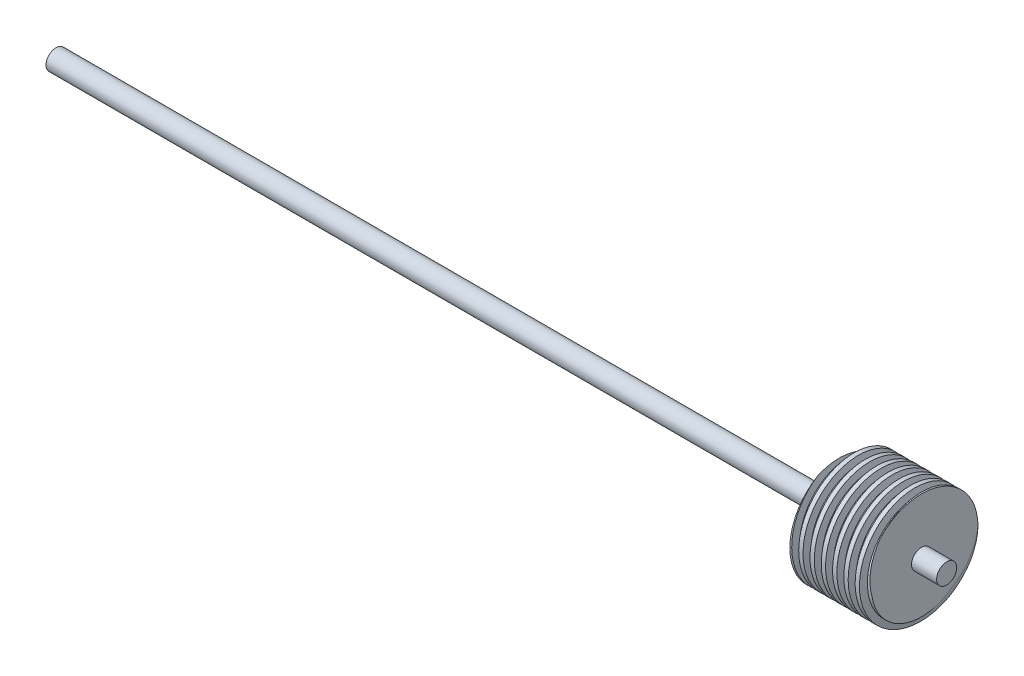
from build123d import *

# Parameters (mm, degrees)
SKETCH1_R                = 22.5
BOSS_EXTRUDE1_DEPTH      = 30
CUT_SWEEP1_PITCH         = 4.5
BOSS_EXTRUDE2_DEPTH      = 315
BOSS_EXTRUDE2_DEPTH_BACK = 40
SKETCH4_R                = 4


with BuildPart() as part:
    # Sketch1 → Boss-Extrude1 (new body)
    with BuildSketch(Plane(origin=(0, 0, 0), x_dir=(0, 0, -1), z_dir=(1, 0, 0))):
        Circle(SKETCH1_R)
    extrude(amount=BOSS_EXTRUDE1_DEPTH)

    # Cut-Sweep1: the profile of Sketch3 profile screwed along a right-hand helix of 14.333333 turns, 12 arcs to a turn; built about Z, then put on its axis
    cut_sweep1_z = Axis((0, 0, 0), (0, 0, 1))
    cut_sweep1_corners = [(22.5003, 0, 7.7585e-05), (22.5003, 0, -2.793165507), (20, 0, -2.146543961), (20, 0, -0.646543961)]
    with BuildLine(mode=Mode.PRIVATE) as cut_sweep1_profile:
        Line(cut_sweep1_corners[0], cut_sweep1_corners[1])
        Line(cut_sweep1_corners[1], cut_sweep1_corners[2])
        Line(cut_sweep1_corners[2], cut_sweep1_corners[3])
        Line(cut_sweep1_corners[3], cut_sweep1_corners[0])
    cut_sweep1_cap = Face(cut_sweep1_profile.wire())
    cut_sweep1_turn_angles = [0, 15, 30, 45, 60, 75, 90, 105, 120, 135, 150, 165, 180, 195, 210, 225, 240, 255, 270, 285, 300, 315, 330, 345, 360]
    cut_sweep1_turn_weights = [1, 0.9659258262890683, 1, 0.9659258262890683, 1, 0.9659258262890683, 1, 0.9659258262890683, 1, 0.9659258262890683, 1, 0.9659258262890683, 1, 0.9659258262890683, 1, 0.9659258262890683, 1, 0.9659258262890683, 1, 0.9659258262890683, 1, 0.9659258262890683, 1, 0.9659258262890683, 1]
    cut_sweep1_turn_rails = [Edge.make_bspline([Vector(p[0], p[1], 0).rotate(cut_sweep1_z, cut_sweep1_turn_angles[k]) / cut_sweep1_turn_weights[k] + Vector(0, 0, p[2] + CUT_SWEEP1_PITCH * cut_sweep1_turn_angles[k] / 360) for k in range(25)], [0, 0, 0, 1, 1, 2, 2, 3, 3, 4, 4, 5, 5, 6, 6, 7, 7, 8, 8, 9, 9, 10, 10, 11, 11, 12, 12, 12], 2, cut_sweep1_turn_weights) for p in cut_sweep1_corners]
    cut_sweep1_turn_sides = [Face.make_surface_from_curves(cut_sweep1_turn_rails[p[0]], cut_sweep1_turn_rails[p[1]]) for p in [(0, 1), (1, 2), (2, 3), (3, 0)]]
    cut_sweep1_last_angles = [5040, 5055, 5070, 5085, 5100, 5115, 5130, 5145, 5160]
    cut_sweep1_last_weights = [1, 0.9659258262890683, 1, 0.9659258262890683, 1, 0.9659258262890683, 1, 0.9659258262890601, 1]
    cut_sweep1_last_rails = [Edge.make_bspline([Vector(p[0], p[1], 0).rotate(cut_sweep1_z, cut_sweep1_last_angles[k]) / cut_sweep1_last_weights[k] + Vector(0, 0, p[2] + CUT_SWEEP1_PITCH * cut_sweep1_last_angles[k] / 360) for k in range(9)], [0, 0, 0, 1, 1, 2, 2, 3, 3, 4, 4, 4], 2, cut_sweep1_last_weights) for p in cut_sweep1_corners]
    cut_sweep1_last_sides = [Face.make_surface_from_curves(cut_sweep1_last_rails[p[0]], cut_sweep1_last_rails[p[1]]) for p in [(0, 1), (1, 2), (2, 3), (3, 0)]]
    cut_sweep1 = Plane(origin=(30, 0, 0), x_dir=(0, 0, -1), z_dir=(-1, 0, 0)) * Solid(Shell([*[p.moved(Location((0, 0, CUT_SWEEP1_PITCH * i))) for i in range(14) for p in cut_sweep1_turn_sides], *cut_sweep1_last_sides, cut_sweep1_cap, cut_sweep1_cap.rotate(cut_sweep1_z, 5160).moved(Location((0, 0, CUT_SWEEP1_PITCH * 5160 / 360)))]))
    add(cut_sweep1, mode=Mode.SUBTRACT)

    # Sketch4 → Boss-Extrude2 (add, two sides: drawn at the far end of the back side and taken through both)
    with BuildSketch(Plane.ZY.offset(-BOSS_EXTRUDE2_DEPTH_BACK)):
        Circle(SKETCH4_R)
    extrude(amount=BOSS_EXTRUDE2_DEPTH + BOSS_EXTRUDE2_DEPTH_BACK)


solid = part.part
